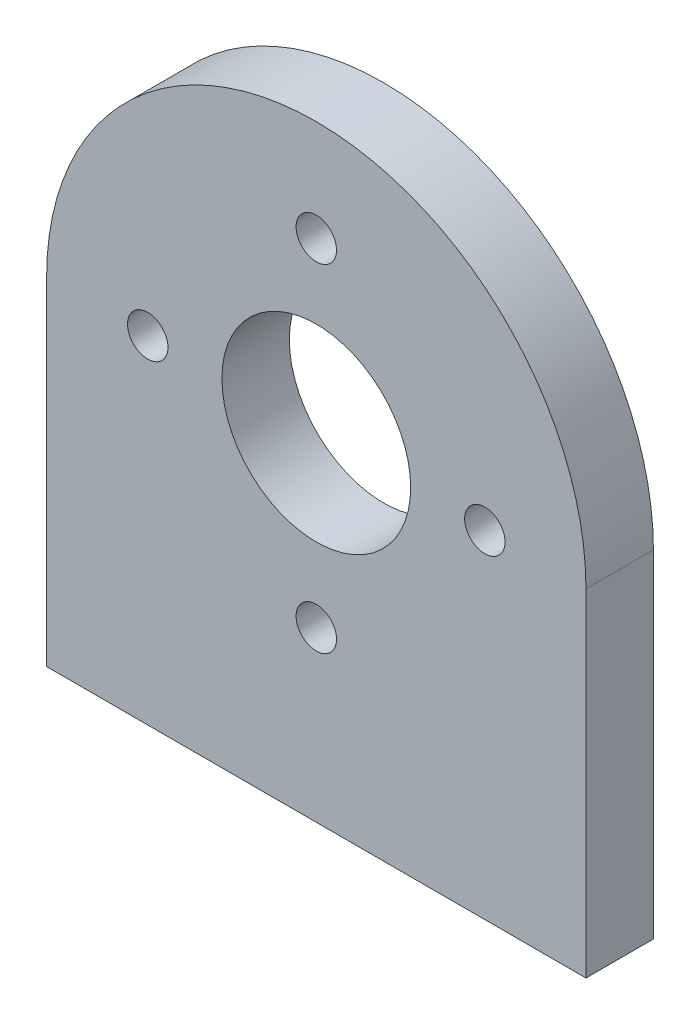
from build123d import *

# Parameters (mm, degrees)
SKETCH1_R           = 7
SKETCH1_R_2         = 1.5
BOSS_EXTRUDE1_DEPTH = 5


with BuildPart() as part:
    # Sketch1 → Boss-Extrude1 (new body)
    with BuildSketch(Plane.XY):
        with BuildLine():
            Line((17.5, -25), (-22.5, -25))
            Line((-22.5, -25), (-22.5, 0))
            ThreePointArc((-22.5, 0), (-2.5, 20), (17.5, 0))
            Line((17.5, 0), (17.5, -25))
        make_face()
        with Locations((-2.5, 0)):
            Circle(SKETCH1_R, mode=Mode.SUBTRACT)
        with Locations((-2.5, -12.5)):
            Circle(SKETCH1_R_2, mode=Mode.SUBTRACT)
        with Locations((-15, 0)):
            Circle(SKETCH1_R_2, mode=Mode.SUBTRACT)
        with Locations((-2.5, 12.5)):
            Circle(SKETCH1_R_2, mode=Mode.SUBTRACT)
        with Locations((10, 0)):
            Circle(SKETCH1_R_2, mode=Mode.SUBTRACT)
    extrude(amount=BOSS_EXTRUDE1_DEPTH)


solid = part.part
